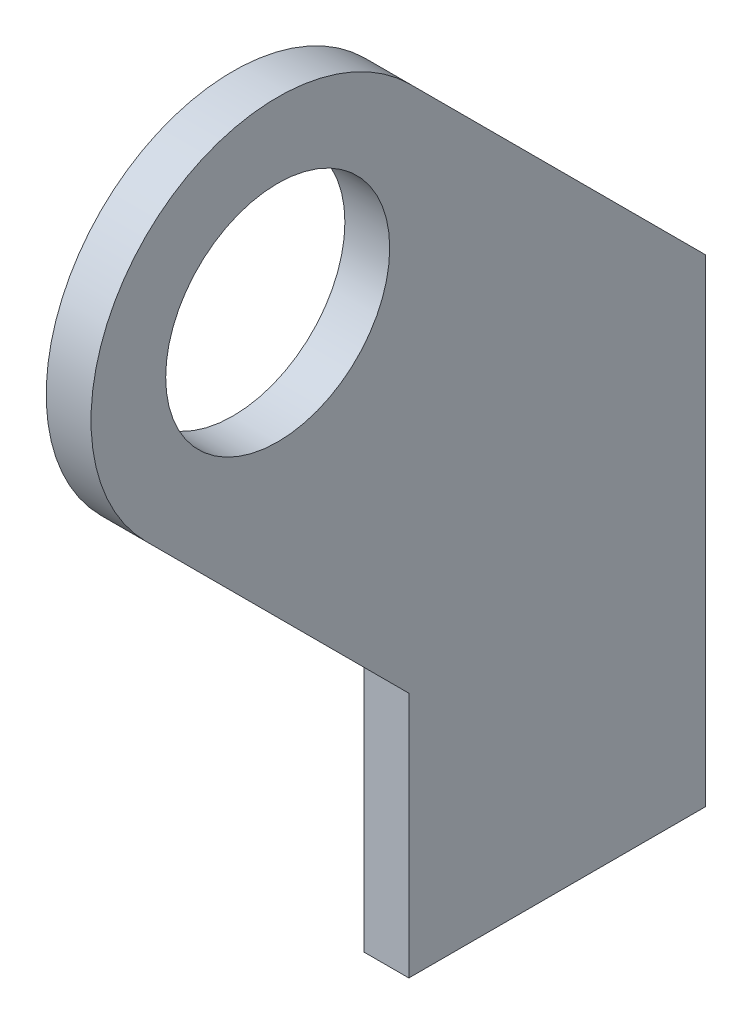
from build123d import *

# Parameters (mm, degrees)
SKETCH1_R           = 7.5
BOSS_EXTRUDE1_DEPTH = 3


with BuildPart() as part:
    # Sketch1 → Boss-Extrude1 (new body)
    with BuildSketch(Plane(origin=(0, 0, 0), x_dir=(0, 0, -1), z_dir=(1, 0, 0))):
        with BuildLine():
            Line((28.652175428, -10.974505899), (8.838834765, 8.838834765))
            ThreePointArc((8.838834765, 8.838834765), (-8.838834765, 8.838834765), (-8.838834765, -8.838834765))
            Line((-8.838834765, -8.838834765), (8.782323517, -26.459993046))
            Line((8.782323517, -26.459993046), (8.782323517, -42.974505899))
            Line((8.782323517, -42.974505899), (28.652175428, -42.974505899))
            Line((28.652175428, -42.974505899), (28.652175428, -10.974505899))
        make_face()
        Circle(SKETCH1_R, mode=Mode.SUBTRACT)
    extrude(amount=BOSS_EXTRUDE1_DEPTH)


solid = part.part
